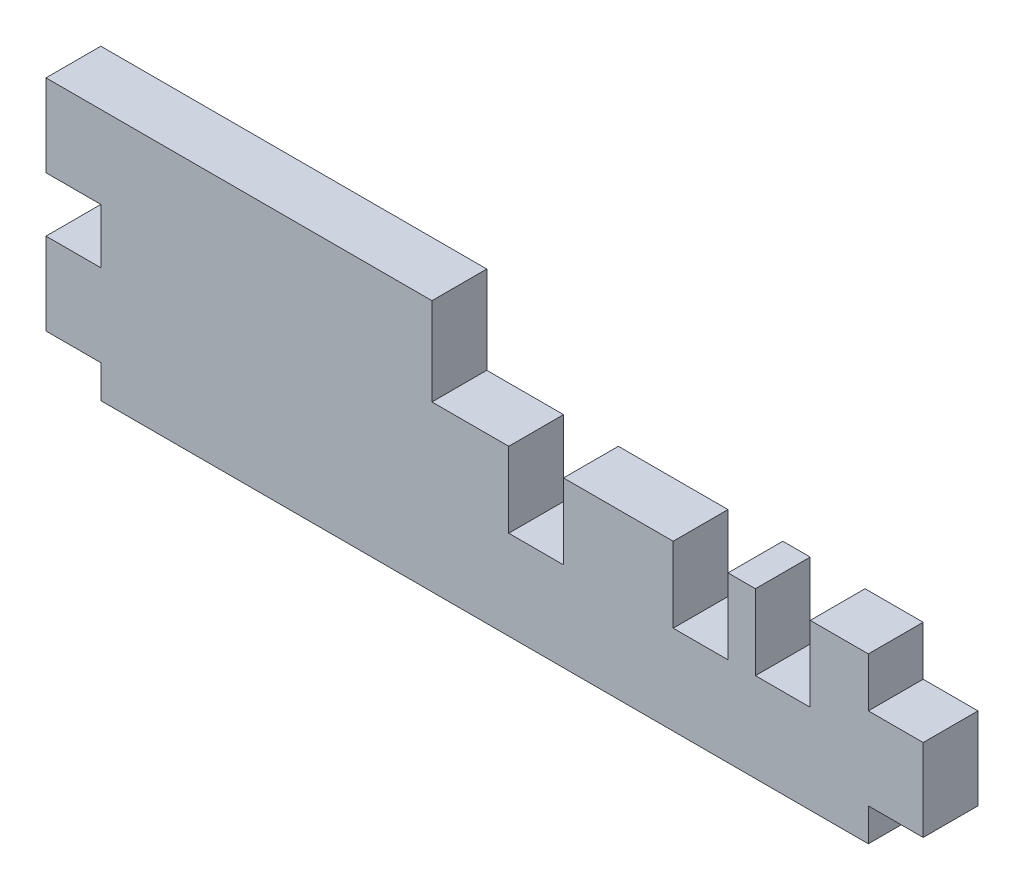
from build123d import *

# Parameters (mm, degrees)
BOSS_EXTRU_1_DEPTH = 5


with BuildPart() as part:
    # Esquisse1 → Boss.-Extru.1 (new body)
    with BuildSketch(Plane.XY):
        Polygon((-5, 0), (0, 0), (0, -3), (70, -3), (70, 0), (75, 0), (75, 7.5), (70, 7.5), (70, 12), (64.7, 12), (64.7, 5.131449412), (59.7, 5.131449412), (59.7, 12), (57.2, 12), (57.2, 5.131449412), (52.2, 5.131449412), (52.2, 12), (42.2, 12), (42.2, 5.131449412), (37.2, 5.131449412), (37.2, 12), (30.2, 12), (30.2, 20), (0, 20), (-5, 20), (-5, 12.5), (0, 12.5), (0, 7.5), (-5, 7.5), align=None)
    extrude(amount=BOSS_EXTRU_1_DEPTH)


solid = part.part
